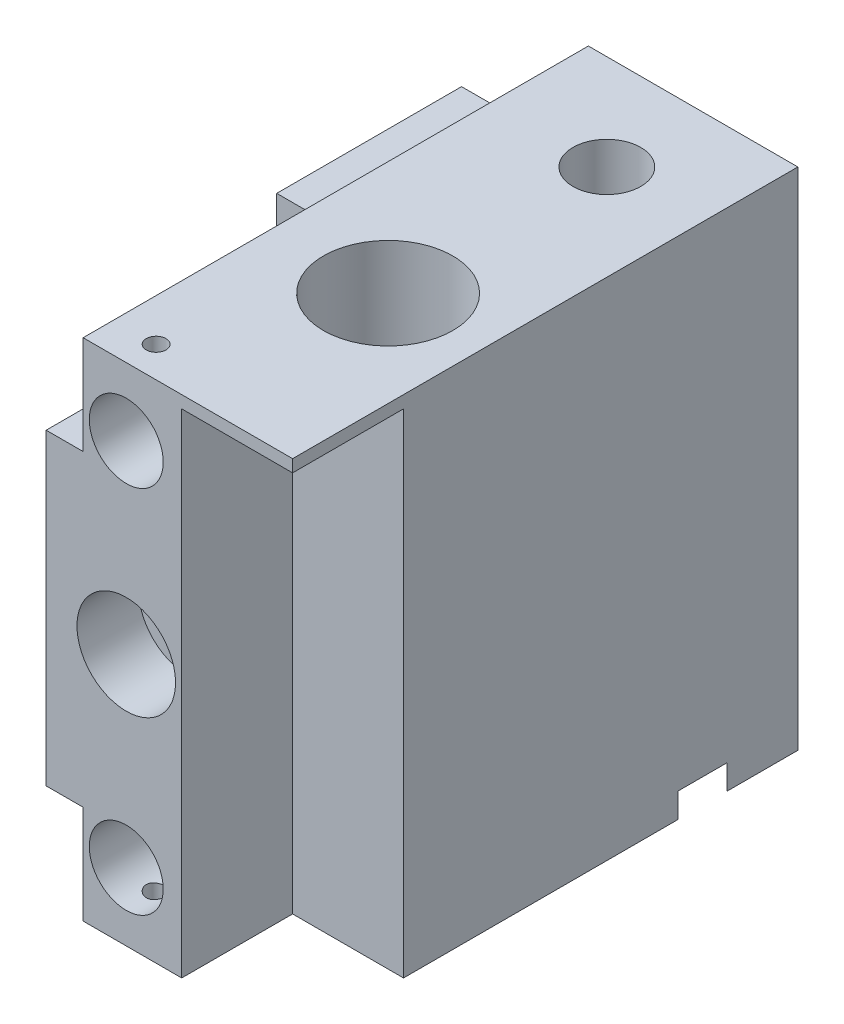
from build123d import *
from build123d.topology import SkipClean

# Parameters (mm, degrees)
SKETCH1_W           = 40
SKETCH1_H           = 82
SKETCH1_R           = 5.5
SKETCH1_R_2         = 6
BOSS_EXTRUDE1_DEPTH = 12
BOSS_EXTRUDE2_START = 70
SKETCH2_W           = 40
SKETCH2_H           = 82
SKETCH2_R           = 5.5
BOSS_EXTRUDE2_DEPTH = 70
SKETCH3_R           = 1.6
CUT_EXTRUDE1_DEPTH  = 10
CUT_EXTRUDE2_START  = -10
SKETCH4_R           = 1.6
CUT_EXTRUDE2_DEPTH  = 10
SKETCH5_R           = 10.5
SKETCH5_R_2         = 5.5
CUT_EXTRUDE3_DEPTH  = 100
SKETCH6_R           = 16
CUT_EXTRUDE4_DEPTH  = 4
SKETCH19_R          = 8.05
CUT_EXTRUDE17_DEPTH = 16
SKETCH12_R          = 1.2
CUT_EXTRUDE12_DEPTH = 12
SKETCH13_W          = 20
SKETCH13_H          = 70
BOSS_EXTRUDE3_DEPTH = 30
CUT_EXTRUDE14_DEPTH = 115
SKETCH22_W          = 18
SKETCH22_H          = 18
CUT_EXTRUDE18_DEPTH = 80
SKETCH23_R          = 8
CUT_EXTRUDE19_DEPTH = 10
SKETCH24_R          = 10
CUT_EXTRUDE20_DEPTH = 2


with BuildPart() as part:
    # Sketch1 → Boss-Extrude1 (new body)
    with BuildSketch(Plane.XY):
        with Locations((-20, -41)):
            Rectangle(SKETCH1_W, SKETCH1_H)
        with Locations((-27, -41)):
            Circle(SKETCH1_R, mode=Mode.SUBTRACT)
        with Locations((-27, -11)):
            Circle(SKETCH1_R_2, mode=Mode.SUBTRACT)
        with Locations((-27, -71)):
            Circle(SKETCH1_R_2, mode=Mode.SUBTRACT)
    extrude(amount=BOSS_EXTRUDE1_DEPTH)

    # Sketch2 → Boss-Extrude2 (add)
    with SkipClean():  # the faces are left unmerged after this step: merging them gives an invalid solid
        with BuildSketch(Plane(origin=(0, 0, 0), x_dir=(-1, 0, 0), z_dir=(0, 0, -1)).offset(BOSS_EXTRUDE2_START)):
            with Locations((20, -41)):
                Rectangle(SKETCH2_W, SKETCH2_H)
            with Locations((27, -41)):
                Circle(SKETCH2_R, mode=Mode.SUBTRACT)
        extrude(amount=-BOSS_EXTRUDE2_DEPTH)

    # Sketch3 → Cut-Extrude1 (cut)
    with SkipClean():  # the faces are left unmerged after this step: merging them gives an invalid solid
        with BuildSketch(Plane(origin=(0, 0, 0), x_dir=(1, 0, 0), z_dir=(0, 1, 0))):
            with Locations((-27.154767421, -7)):
                Circle(SKETCH3_R)
        extrude(amount=-CUT_EXTRUDE1_DEPTH, mode=Mode.SUBTRACT)

    # Sketch4 → Cut-Extrude2 (cut)
    with SkipClean():  # the faces are left unmerged after this step: merging them gives an invalid solid
        with BuildSketch(Plane.XZ.offset(82).offset(CUT_EXTRUDE2_START)):
            with Locations((-27.154767421, 7)):
                Circle(SKETCH4_R)
        extrude(amount=CUT_EXTRUDE2_DEPTH, mode=Mode.SUBTRACT)

    # Sketch5 → Cut-Extrude3 (cut)
    with SkipClean():  # the faces are left unmerged after this step: merging them gives an invalid solid
        with BuildSketch(Plane(origin=(0, 0, 0), x_dir=(1, 0, 0), z_dir=(0, 1, 0))):
            with Locations((-15.5, 19)):
                Circle(SKETCH5_R)
            with Locations((-15.5, 54.5)):
                Circle(SKETCH5_R_2)
        extrude(amount=-CUT_EXTRUDE3_DEPTH, mode=Mode.SUBTRACT)

    # Sketch6 → Cut-Extrude4 (cut)
    with SkipClean():  # the faces are left unmerged after this step: merging them gives an invalid solid
        with BuildSketch(Plane(origin=(0, -82, 0), x_dir=(1, 0, 0), z_dir=(0, 1, 0))):
            with Locations((-15.5, 54.5)):
                Circle(SKETCH6_R)
        extrude(amount=CUT_EXTRUDE4_DEPTH, mode=Mode.SUBTRACT)

    # Sketch19 → Cut-Extrude17 (cut)
    with SkipClean():  # the faces are left unmerged after this step: merging them gives an invalid solid
        with BuildSketch(Plane(origin=(0, -78, 0), x_dir=(-1, 0, 0), z_dir=(0, -1, 0))):
            with Locations((15.5, 54.5)):
                Circle(SKETCH19_R)
        extrude(amount=-CUT_EXTRUDE17_DEPTH, mode=Mode.SUBTRACT)

    # Sketch12 → Cut-Extrude12 (cut)
    with SkipClean():  # the faces are left unmerged after this step: merging them gives an invalid solid
        with BuildSketch(Plane(origin=(0, -78, 0), x_dir=(-1, 0, 0), z_dir=(0, -1, 0))):
            with Locations((11.517229373, 43.180214749)):
                Circle(SKETCH12_R)
            with Locations((26.819785251, 50.517229373)):
                Circle(SKETCH12_R)
            with Locations((19.482770627, 65.819785251)):
                Circle(SKETCH12_R)
            with Locations((4.180214749, 58.482770627)):
                Circle(SKETCH12_R)
        extrude(amount=-CUT_EXTRUDE12_DEPTH, mode=Mode.SUBTRACT)

    # Sketch13 → Boss-Extrude3 (add)
    with SkipClean():  # the faces are left unmerged after this step: merging them gives an invalid solid
        with BuildSketch(Plane(origin=(0, 0, -70), x_dir=(-1, 0, 0), z_dir=(0, 0, -1))):
            with Locations((50, -35)):
                Rectangle(SKETCH13_W, SKETCH13_H)
        extrude(amount=-BOSS_EXTRUDE3_DEPTH)

    # Sketch15 → Cut-Extrude14 (cut)
    with SkipClean():  # the faces are left unmerged after this step: merging them gives an invalid solid
        with BuildSketch(Plane(origin=(0, 0, -70), x_dir=(-1, 0, 0), z_dir=(0, 0, -1))):
            Polygon((34, 0), (34, -16), (54.581085422, -16), (54.581085422, -66), (34, -66), (34, -82), (77.520554958, -82), (77.520554958, 0), align=None)
        extrude(amount=-CUT_EXTRUDE14_DEPTH, mode=Mode.SUBTRACT)

    # Sketch22 → Cut-Extrude18 (cut)
    with SkipClean():  # the faces are left unmerged after this step: merging them gives an invalid solid
        with BuildSketch(Plane.XZ.offset(82)):
            with Locations((-9, 3)):
                Rectangle(SKETCH22_W, SKETCH22_H)
        extrude(amount=-CUT_EXTRUDE18_DEPTH, mode=Mode.SUBTRACT)

    # Sketch23 → Cut-Extrude19 (cut)
    with SkipClean():  # the faces are left unmerged after this step: merging them gives an invalid solid
        with BuildSketch(Plane.XY.offset(12)):
            with Locations((-27, -41)):
                Circle(SKETCH23_R)
        extrude(amount=-CUT_EXTRUDE19_DEPTH, mode=Mode.SUBTRACT)

    # Sketch24 → Cut-Extrude20 (cut)
    with BuildSketch(Plane(origin=(0, 0, -70), x_dir=(-1, 0, 0), z_dir=(0, 0, -1))):
        with Locations((27, -41)):
            Circle(SKETCH24_R)
    extrude(amount=-CUT_EXTRUDE20_DEPTH, mode=Mode.SUBTRACT)


solid = part.part
